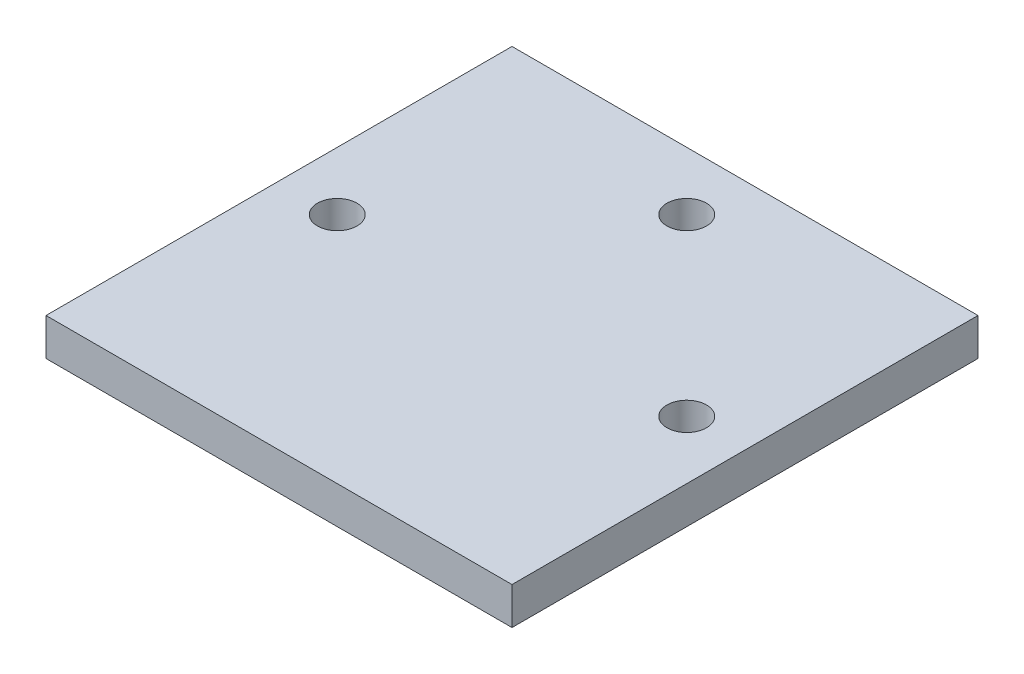
from build123d import *

# Parameters (mm, degrees)
SKETCH_1_W             = 200
SKETCH_1_H             = 200
SKETCH_1_R             = 8.5
SM_BASE_FLANGE_1_DEPTH = 16


# Sheet-metal steps are written as plain solids
with BuildPart() as part:
    # Sketch 1 → Базовая кромка1 (new body)
    with BuildSketch(Plane(origin=(0, 0, 0), x_dir=(1, 0, 0), z_dir=(0, 1, 0))):
        Rectangle(SKETCH_1_W, SKETCH_1_H)
        with Locations(Location((0, 75, 0), (0, 0, 270))):
            Circle(SKETCH_1_R, mode=Mode.SUBTRACT)
        with Locations(Location((-75, 0, 0), (0, 0, 270))):
            Circle(SKETCH_1_R, mode=Mode.SUBTRACT)
        with Locations(Location((75, 0, 0), (0, 0, 270))):
            Circle(SKETCH_1_R, mode=Mode.SUBTRACT)
    extrude(amount=-SM_BASE_FLANGE_1_DEPTH)


solid = part.part
